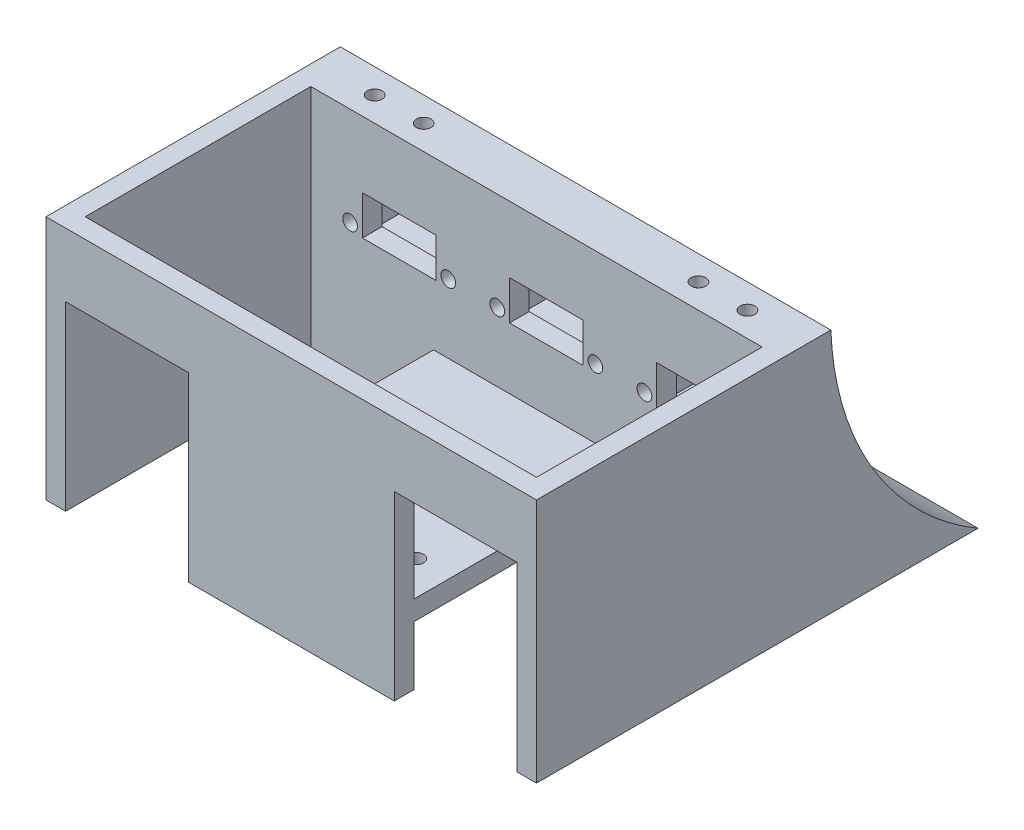
from build123d import *

# Parameters (mm, degrees)
CROQUIS1_W                          = 100
CROQUIS1_H                          = 60
SALIENTE_EXTRUIR1_DEPTH             = 50
VACIADO1_T                          = -4
SALIENTE_EXTRUIR2_REACH             = 78.811
SALIENTE_EXTRUIR2_DIRECTION_2_REACH = 78.811
CORTAR_EXTRUIR1_START               = -4
CROQUIS3_W                          = 44
CROQUIS3_H                          = 37
CORTAR_EXTRUIR1_DEPTH               = 25
CROQUIS5_W                          = 92
CROQUIS5_H                          = 46
SALIENTE_EXTRUIR3_DEPTH             = 6
CORTAR_EXTRUIR2_START               = 2
CROQUIS4_W                          = 26
CROQUIS4_H                          = 13
CORTAR_EXTRUIR2_DEPTH               = 13
CROQUIS4_3_R                        = 1.5
CROQUIS4_3_W                        = 15
CROQUIS4_3_H                        = 8
CORTAR_EXTRUIR3_DEPTH               = 6
MATRIZL2_COUNT                      = 3
MATRIZL2_PITCH                      = 30
SALIENTE_EXTRUIR4_START             = 8
SALIENTE_EXTRUIR4_DEPTH             = 4
CORTAR_EXTRUIR4_DEPTH               = 4
CROQUIS7_R                          = 1.5
CROQUIS7_W                          = 25
CROQUIS7_H                          = 6
CORTAR_EXTRUIR5_DEPTH               = 4
CORTAR_EXTRUIR6_START               = -2
CORTAR_EXTRUIR6_DEPTH               = 2
CROQUIS9_R                          = 1.5
CORTAR_EXTRUIR7_DEPTH               = 5


# Read off the part's stored shape, not the designer's step: Cortar-Extruir6
with BuildPart() as part:
    # Croquis1 → Saliente-Extruir1 (new body)
    with BuildSketch(Plane(origin=(0, 0, 0), x_dir=(1, 0, 0), z_dir=(0, 1, 0))):
        Rectangle(CROQUIS1_W, CROQUIS1_H)
    extrude(amount=SALIENTE_EXTRUIR1_DEPTH)

    # Vaciado1
    vaciado1_openings = [part.faces().sort_by_distance(p)[0] for p in [
        (0, 50, 0),
    ]]
    offset(amount=VACIADO1_T, openings=vaciado1_openings, kind=Kind.INTERSECTION)

    # Saliente-Extruir2: up to this face of the body (flat: up to its plane)
    saliente_extruir2_end = Plane(part.part.faces().sort_by_distance((50, 25, 0))[0])
    # Croquis2 → Saliente-Extruir2 (add, up to the picked face)
    with BuildSketch(Plane(origin=(0, 0, 0), x_dir=(0, 0, -1), z_dir=(1, 0, 0)), mode=Mode.PRIVATE) as saliente_extruir2_sk1:
        with BuildLine():
            Line((30, 50), (30, 0))
            Line((30, 0), (60, 0))
            ThreePointArc((60, 0), (38.605216469, 21.163129881), (30, 50))
        make_face()
    saliente_extruir2_tool1 = split(extrude(saliente_extruir2_sk1.sketch, amount=SALIENTE_EXTRUIR2_REACH, mode=Mode.PRIVATE), bisect_by=saliente_extruir2_end, keep=Keep.BOTH, mode=Mode.PRIVATE)
    add(saliente_extruir2_tool1.solids().sort_by(Axis((0, 12.297195, -38.437511), (1, 0, 0)))[0])

    # Saliente-Extruir2 direction 2: up to this face of the body (flat: up to its plane)
    saliente_extruir2_direction_2_end = Plane(part.part.faces().sort_by_distance((-50, 25, 0))[0])
    # Croquis2 → Saliente-Extruir2 direction 2 (add, up to the picked face)
    with BuildSketch(Plane(origin=(0, 0, 0), x_dir=(0, 0, -1), z_dir=(1, 0, 0)), mode=Mode.PRIVATE) as saliente_extruir2_direction_2_sk1:
        with BuildLine():
            Line((30, 50), (30, 0))
            Line((30, 0), (60, 0))
            ThreePointArc((60, 0), (38.605216469, 21.163129881), (30, 50))
        make_face()
    saliente_extruir2_direction_2_tool1 = split(extrude(saliente_extruir2_direction_2_sk1.sketch, amount=-SALIENTE_EXTRUIR2_DIRECTION_2_REACH, mode=Mode.PRIVATE), bisect_by=saliente_extruir2_direction_2_end, keep=Keep.BOTH, mode=Mode.PRIVATE)
    add(saliente_extruir2_direction_2_tool1.solids().sort_by(Axis((0, 12.297195, -38.437511), (-1, 0, 0)))[0])

    # Croquis3 → Cortar-Extruir1 (cut)
    with BuildSketch(Plane.ZY.offset(50).offset(CORTAR_EXTRUIR1_START)):
        with Locations((8, 18.5)):
            Rectangle(CROQUIS3_W, CROQUIS3_H)
    cortar_extruir1 = extrude(amount=-CORTAR_EXTRUIR1_DEPTH, mode=Mode.SUBTRACT)

    # Croquis5 → Saliente-Extruir3 (add)
    with BuildSketch(Plane.XY.offset(-26)):
        with Locations((0, 27)):
            Rectangle(CROQUIS5_W, CROQUIS5_H)
    extrude(amount=SALIENTE_EXTRUIR3_DEPTH)

    # Croquis4 → Cortar-Extruir2 (cut)
    with BuildSketch(Plane.XY.offset(-26).offset(CORTAR_EXTRUIR2_START)):
        with Locations((-28, 30)):
            Rectangle(CROQUIS4_W, CROQUIS4_H)
    cortar_extruir2 = extrude(amount=-CORTAR_EXTRUIR2_DEPTH, mode=Mode.SUBTRACT)

    # Croquis4<3> → Cortar-Extruir3 (cut)
    with BuildSketch(Plane.XY.offset(-26)):
        with Locations((-18, 30)):
            Circle(CROQUIS4_3_R)
        with Locations((-38, 30)):
            Circle(CROQUIS4_3_R)
        with Locations((-28, 32.5)):
            Rectangle(CROQUIS4_3_W, CROQUIS4_3_H)
    cortar_extruir3 = extrude(amount=CORTAR_EXTRUIR3_DEPTH, mode=Mode.SUBTRACT)

    # MatrizL2: Cortar-Extruir2, Cortar-Extruir3 ×3
    with Locations(*[(i * MATRIZL2_PITCH, 0, 0) for i in range(1, MATRIZL2_COUNT)]):
        add(cortar_extruir2, mode=Mode.SUBTRACT)
        add(cortar_extruir3, mode=Mode.SUBTRACT)

    # Croquis6 → Saliente-Extruir4 (add)
    with BuildSketch(Plane(origin=(0, 4, 0), x_dir=(1, 0, 0), z_dir=(0, 1, 0)).offset(SALIENTE_EXTRUIR4_START)):
        Polygon((46, 20), (-46, 20), (-46, 14), (-21, 14), (-21, -26), (46, -26), align=None)
    extrude(amount=SALIENTE_EXTRUIR4_DEPTH)

    # Croquis6<2> → Cortar-Extruir4 (cut)
    with BuildSketch(Plane(origin=(0, 4, 0), x_dir=(1, 0, 0), z_dir=(0, 1, 0))):
        Polygon((46, 20), (-46, 20), (-46, 14), (-21, 14), (-21, -26), (46, -26), align=None)
    extrude(amount=-CORTAR_EXTRUIR4_DEPTH, mode=Mode.SUBTRACT)

    # Croquis7 → Cortar-Extruir5 (cut)
    with BuildSketch(Plane(origin=(0, 16, 0), x_dir=(1, 0, 0), z_dir=(0, 1, 0))):
        with Locations(Location((-14.1, -18.6, 0), (0, 0, 270))):
            Circle(CROQUIS7_R)
        with Locations(Location((-14.1, 4.4, 0), (0, 0, 270))):
            Circle(CROQUIS7_R)
        with Locations((-33.5, 17)):
            Rectangle(CROQUIS7_W, CROQUIS7_H)
    cortar_extruir5 = extrude(amount=-CORTAR_EXTRUIR5_DEPTH, mode=Mode.SUBTRACT)

    # Cortar-Extruir6 outline → Cortar-Extruir6 (cut)
    # profile 1 of 7: a face of its own
    with BuildSketch(Plane.XZ.offset(CORTAR_EXTRUIR6_START)):
        with BuildLine():
            add(Edge.make_bspline(
                [(18.888271585, -42.352393977), (18.884484386, -42.423868512), (18.876982857, -42.565442321), (18.813577354, -42.76853097), (18.712467671, -42.954955074), (18.571846334, -43.120483121), (18.394972631, -43.265694686), (18.179407906, -43.375225333), (17.935081569, -43.448844865), (17.76258819, -43.457813268), (17.674797559, -43.462377743)],
                knots=[0, 0, 0, 0, 0.116932385, 0.231614839, 0.34522054, 0.462467825, 0.585400328, 0.717791731, 0.856369898, 1, 1, 1, 1], degree=3))
            add(Edge.make_bspline(
                [(17.674797559, -41.254585535), (17.763389132, -41.258694265), (17.935697765, -41.266685653), (18.177177697, -41.34503228), (18.392463639, -41.452351176), (18.571177721, -41.596634907), (18.717121011, -41.760131049), (18.814170619, -41.947213877), (18.876740836, -42.145501203), (18.884400246, -42.282931699), (18.888271585, -42.352393977)],
                knots=[0, 0, 0, 0, 0.145662332, 0.283309988, 0.415047197, 0.54050675, 0.659953064, 0.773758148, 0.885649294, 1, 1, 1, 1], degree=3))
            add(Edge.make_bspline(
                [(16.58307678, -42.364569301), (16.58652142, -42.28696319), (16.593261486, -42.135112676), (16.659638507, -41.918883094), (16.759439169, -41.72601533), (16.895115639, -41.562632424), (17.056479671, -41.427973634), (17.246142952, -41.331900385), (17.45395748, -41.26494248), (17.600539476, -41.258068086), (17.674797559, -41.254585535)],
                knots=[0, 0, 0, 0, 0.133733755, 0.26167449, 0.387130703, 0.506684142, 0.62623758, 0.747503629, 0.872085953, 1, 1, 1, 1], degree=3))
            add(Edge.make_bspline(
                [(17.674797559, -43.462377743), (17.599321746, -43.458606869), (17.451193809, -43.451206198), (17.239787685, -43.389378358), (17.054227298, -43.287246715), (16.890184198, -43.159675217), (16.758807001, -42.997357071), (16.658466944, -42.808565511), (16.593408285, -42.593932994), (16.58657107, -42.442143981), (16.58307678, -42.364569301)],
                knots=[0, 0, 0, 0, 0.130782073, 0.256671348, 0.377953313, 0.496525494, 0.614923347, 0.737239779, 0.865711362, 1, 1, 1, 1], degree=3))
        make_face()
    # profile 2 of 7: a face of its own
    with BuildSketch(Plane.XZ.offset(CORTAR_EXTRUIR6_START)):
        with BuildLine():
            add(Edge.make_bspline(
                [(9.961729377, -33.202637483), (10.078086415, -33.20396258), (10.306179155, -33.206560146), (10.641305435, -33.222314884), (10.962051584, -33.251193631), (11.269559714, -33.289071545), (11.563563058, -33.33939217), (11.843716201, -33.402618139), (12.109982733, -33.475309646), (12.36257057, -33.558790311), (12.602442614, -33.652057186), (12.830212297, -33.755455269), (13.045308722, -33.869305582), (13.248379923, -33.991384069), (13.440925399, -34.120089244), (13.616724077, -34.264275749), (13.783741804, -34.412883651), (13.986441364, -34.625165883), (14.214017896, -34.910386783), (14.44526318, -35.283963823), (14.630151513, -35.689662854), (14.772665977, -36.123167), (14.879795025, -36.58187545), (14.952457445, -37.063099713), (15.001942006, -37.566460721), (15.006217323, -37.909628466), (15.008401455, -38.084942678)],
                knots=[0, 0, 0, 0, 0.043180069, 0.084645162, 0.124459927, 0.162661114, 0.199594386, 0.235096819, 0.269197997, 0.301980353, 0.333770389, 0.364660784, 0.394752534, 0.424024931, 0.452569381, 0.48059819, 0.508323011, 0.535484198, 0.589424801, 0.643410939, 0.698108386, 0.754465297, 0.812487963, 0.872697628, 0.934964998, 1, 1, 1, 1], degree=3))
            Line((9.961729377, -33.202637483), (5.771388468, -33.202637483))
            Line((5.771388468, -33.202637483), (5.771388468, -33.981858262))
            Line((5.771388468, -33.981858262), (7.116761845, -33.981858262))
            Line((7.116761845, -33.981858262), (7.116761845, -42.423416704))
            Line((7.116761845, -42.423416704), (5.771388468, -42.423416704))
            Line((5.771388468, -42.423416704), (5.771388468, -43.202637483))
            Line((5.771388468, -43.202637483), (9.860268339, -43.202637483))
            add(Edge.make_bspline(
                [(15.008401455, -38.084942678), (15.004738902, -38.291405953), (14.997407606, -38.704681395), (14.941688972, -39.218452009), (14.875402695, -39.625366999), (14.808741523, -39.92495049), (14.724708647, -40.218768001), (14.626169232, -40.505712764), (14.51053056, -40.785736663), (14.374241877, -41.055312379), (14.219607314, -41.315622483), (14.047019061, -41.566374551), (13.852501182, -41.806201693), (13.62690437, -42.0271023), (13.376968106, -42.234899034), (13.098980862, -42.425828897), (12.794904929, -42.601762358), (12.459414016, -42.751394481), (12.099579316, -42.889914253), (11.70885419, -43.001415556), (11.289882939, -43.094852833), (10.839633371, -43.153985425), (10.360310068, -43.197604147), (10.030157565, -43.200927406), (9.860268339, -43.202637483)],
                knots=[0, 0, 0, 0, 0.074322882, 0.148771358, 0.185807886, 0.222738558, 0.25920372, 0.295789058, 0.331928241, 0.368198494, 0.404454025, 0.440867911, 0.477727844, 0.515443619, 0.554360706, 0.594625465, 0.636736502, 0.680657414, 0.726750954, 0.775461095, 0.826815655, 0.881167312, 0.938851309, 1, 1, 1, 1], degree=3))
        make_face()
        with BuildLine():
            add(Edge.make_bspline(
                [(13.159781326, -38.099147223), (13.158632612, -37.983481359), (13.156381956, -37.756859088), (13.149635749, -37.424590376), (13.13240756, -37.10666968), (13.111310337, -36.803388039), (13.080698489, -36.515776375), (13.043579106, -36.244514677), (12.992432815, -35.990643527), (12.931685925, -35.752860866), (12.862116119, -35.531008526), (12.777204563, -35.327104304), (12.68554965, -35.136670312), (12.576272511, -34.963955156), (12.457389878, -34.803322315), (12.318766809, -34.660812858), (12.167259448, -34.529720799), (11.996238881, -34.416626125), (11.810081477, -34.312825201), (11.601716837, -34.227092534), (11.373790391, -34.152133468), (11.125100472, -34.08902294), (10.854490136, -34.04079603), (10.561657054, -34.00775423), (10.246213269, -33.983813067), (10.028067166, -33.982525357), (9.9150573, -33.981858262)],
                knots=[0, 0, 0, 0, 0.056108201, 0.109931898, 0.161182084, 0.210528593, 0.257377396, 0.301457147, 0.343281306, 0.382910323, 0.42047119, 0.455931338, 0.489972749, 0.522838048, 0.554926075, 0.586717515, 0.619066154, 0.65191671, 0.685983409, 0.722301395, 0.761001391, 0.802301068, 0.846642567, 0.894216443, 0.945199179, 1, 1, 1, 1], degree=3))
            add(Edge.make_bspline(
                [(9.773011845, -42.423416704), (9.934758077, -42.421383786), (10.243819718, -42.417499326), (10.684926964, -42.380177837), (11.081683396, -42.324191183), (11.435541481, -42.240266101), (11.749786376, -42.123775868), (12.02857349, -41.974698801), (12.269879393, -41.785964231), (12.479838904, -41.562716937), (12.655318795, -41.295723843), (12.800559432, -40.985532476), (12.919944821, -40.632283672), (12.992811461, -40.307447484), (13.039660285, -40.024661374), (13.071938869, -39.793228818), (13.1008174, -39.547056154), (13.122770551, -39.285814874), (13.138407109, -39.009702532), (13.150412184, -38.719490026), (13.159259354, -38.414406806), (13.159604367, -38.206026271), (13.159781326, -38.099147223)],
                knots=[0, 0, 0, 0, 0.074436008, 0.142230916, 0.203611821, 0.258737414, 0.30928069, 0.357486624, 0.40363574, 0.449674445, 0.497945689, 0.550030491, 0.60694023, 0.669249064, 0.703031575, 0.738873314, 0.776797949, 0.817107808, 0.859524554, 0.904086725, 0.950805773, 1, 1, 1, 1], degree=3))
            Line((9.773011845, -42.423416704), (8.817248858, -42.423416704))
            Line((8.817248858, -42.423416704), (8.817248858, -33.981858262))
            Line((8.817248858, -33.981858262), (9.9150573, -33.981858262))
        make_face(mode=Mode.SUBTRACT)
    # profile 3 of 7: a face of its own
    with BuildSketch(Plane.XZ.offset(CORTAR_EXTRUIR6_START)):
        with BuildLine():
            add(Edge.make_bspline(
                [(4.6025573, -42.352393977), (4.5987701, -42.423868512), (4.591268571, -42.565442321), (4.527863068, -42.76853097), (4.426753385, -42.954955074), (4.286132049, -43.120483121), (4.109258346, -43.265694686), (3.89369362, -43.375225333), (3.649367283, -43.448844865), (3.476873904, -43.457813268), (3.389083274, -43.462377743)],
                knots=[0, 0, 0, 0, 0.116932385, 0.231614839, 0.34522054, 0.462467825, 0.585400328, 0.717791731, 0.856369898, 1, 1, 1, 1], degree=3))
            add(Edge.make_bspline(
                [(3.389083274, -41.254585535), (3.477674846, -41.258694265), (3.64998348, -41.266685653), (3.891463411, -41.34503228), (4.106749353, -41.452351176), (4.285463436, -41.596634907), (4.431406726, -41.760131049), (4.528456334, -41.947213877), (4.591026551, -42.145501203), (4.59868596, -42.282931699), (4.6025573, -42.352393977)],
                knots=[0, 0, 0, 0, 0.145662332, 0.283309988, 0.415047197, 0.54050675, 0.659953064, 0.773758148, 0.885649294, 1, 1, 1, 1], degree=3))
            add(Edge.make_bspline(
                [(2.297362494, -42.364569301), (2.300807134, -42.28696319), (2.3075472, -42.135112676), (2.373924222, -41.918883094), (2.473724883, -41.72601533), (2.609401354, -41.562632424), (2.770765386, -41.427973634), (2.960428666, -41.331900385), (3.168243194, -41.26494248), (3.314825191, -41.258068086), (3.389083274, -41.254585535)],
                knots=[0, 0, 0, 0, 0.133733755, 0.26167449, 0.387130703, 0.506684142, 0.62623758, 0.747503629, 0.872085953, 1, 1, 1, 1], degree=3))
            add(Edge.make_bspline(
                [(3.389083274, -43.462377743), (3.31360746, -43.458606869), (3.165479523, -43.451206198), (2.954073399, -43.389378358), (2.768513012, -43.287246715), (2.604469912, -43.159675217), (2.473092715, -42.997357071), (2.372752659, -42.808565511), (2.307693999, -42.593932994), (2.300856784, -42.442143981), (2.297362494, -42.364569301)],
                knots=[0, 0, 0, 0, 0.130782073, 0.256671348, 0.377953313, 0.496525494, 0.614923347, 0.737239779, 0.865711362, 1, 1, 1, 1], degree=3))
        make_face()
    # profile 4 of 7: a face of its own
    with BuildSketch(Plane.XZ.offset(CORTAR_EXTRUIR6_START)):
        with BuildLine():
            add(Edge.make_bspline(
                [(-3.93843296, -37.618221899), (-3.866724146, -37.617956306), (-3.730718823, -37.617452575), (-3.538649118, -37.610474934), (-3.368606751, -37.603920455), (-3.219564747, -37.58973592), (-3.087319514, -37.569939739), (-2.972740665, -37.531903837), (-2.870914516, -37.48616399), (-2.782415559, -37.423675609), (-2.707169746, -37.339970181), (-2.640560877, -37.236934022), (-2.586763342, -37.109184649), (-2.536583513, -36.956836816), (-2.494399188, -36.767296058), (-2.45907824, -36.532699185), (-2.429754946, -36.248203247), (-2.414574041, -36.041564366), (-2.406371272, -35.92991021)],
                knots=[0, 0, 0, 0, 0.077918038, 0.147781943, 0.208861328, 0.262765604, 0.310498151, 0.353734685, 0.393522182, 0.431460662, 0.470473383, 0.515123849, 0.564157341, 0.620640993, 0.689287881, 0.774847026, 0.878342037, 1, 1, 1, 1], degree=3))
            Line((-3.93843296, -37.618221899), (-4.559374519, -37.618221899))
            Line((-4.559374519, -37.618221899), (-4.559374519, -33.981858262))
            Line((-4.559374519, -33.981858262), (-2.68843296, -33.981858262))
            add(Edge.make_bspline(
                [(-0.36903361, -36.18965047), (-0.387720016, -36.066387923), (-0.422831537, -35.834779149), (-0.485798383, -35.512698009), (-0.549465718, -35.237328029), (-0.618077827, -35.004681033), (-0.69735547, -34.807676051), (-0.782525138, -34.634170654), (-0.887279014, -34.488204407), (-1.002541053, -34.362293406), (-1.136080659, -34.259130945), (-1.288023053, -34.172833804), (-1.461971895, -34.106401825), (-1.658008907, -34.059212051), (-1.877035529, -34.022353755), (-2.1226234, -34.000483018), (-2.395964112, -33.982543953), (-2.58761115, -33.982094638), (-2.68843296, -33.981858262)],
                knots=[0, 0, 0, 0, 0.100276022, 0.188417382, 0.263906678, 0.327592325, 0.383263949, 0.434608959, 0.482616625, 0.527272883, 0.57146264, 0.617759396, 0.667371346, 0.720685132, 0.77972221, 0.84588167, 0.918921319, 1, 1, 1, 1], degree=3))
            Line((-0.36903361, -36.18965047), (0.475122235, -36.18965047))
            Line((0.475122235, -36.18965047), (0.331047559, -33.202637483))
            Line((0.331047559, -33.202637483), (-7.605234908, -33.202637483))
            Line((-7.605234908, -33.202637483), (-7.605234908, -33.981858262))
            Line((-7.605234908, -33.981858262), (-6.259861532, -33.981858262))
            Line((-6.259861532, -33.981858262), (-6.259861532, -42.423416704))
            Line((-6.259861532, -42.423416704), (-7.605234908, -42.423416704))
            Line((-7.605234908, -42.423416704), (-7.605234908, -43.202637483))
            Line((-7.605234908, -43.202637483), (0.499472884, -43.202637483))
            Line((0.499472884, -43.202637483), (0.643547559, -39.566273847))
            Line((0.643547559, -39.566273847), (-0.200608285, -39.566273847))
            add(Edge.make_bspline(
                [(-3.037458934, -42.423416704), (-2.95222315, -42.423254394), (-2.788472159, -42.422942572), (-2.553037934, -42.414305081), (-2.337211579, -42.402219708), (-2.081856363, -42.382501774), (-1.794688199, -42.339357379), (-1.485289246, -42.254108032), (-1.220491867, -42.130934321), (-1.034926991, -41.992295598), (-0.909010628, -41.860943165), (-0.822336186, -41.746617676), (-0.741094244, -41.618226653), (-0.665393011, -41.474258435), (-0.595410692, -41.313843199), (-0.527531275, -41.137768625), (-0.469924642, -40.943172154), (-0.414281031, -40.729335796), (-0.361595237, -40.487420782), (-0.307025844, -40.212838439), (-0.252271604, -39.901609544), (-0.218438939, -39.682008859), (-0.200608285, -39.566273847)],
                knots=[0, 0, 0, 0, 0.05445262, 0.104611819, 0.150493048, 0.192553926, 0.268220917, 0.335654327, 0.396929789, 0.45371437, 0.482445036, 0.512956787, 0.545206301, 0.579422652, 0.616763016, 0.656973875, 0.699898362, 0.746331873, 0.798126817, 0.858046255, 0.925186852, 1, 1, 1, 1], degree=3))
            Line((-3.037458934, -42.423416704), (-4.559374519, -42.423416704))
            Line((-4.559374519, -42.423416704), (-4.559374519, -38.397442678))
            Line((-4.559374519, -38.397442678), (-3.93843296, -38.397442678))
            add(Edge.make_bspline(
                [(-2.408400493, -40.215624496), (-2.415235091, -40.101943361), (-2.427939171, -39.890634033), (-2.454259566, -39.59831022), (-2.482784406, -39.354223102), (-2.519522466, -39.154213795), (-2.562462387, -38.989898952), (-2.611932202, -38.851058474), (-2.674743506, -38.736996361), (-2.747550901, -38.642848259), (-2.83611049, -38.569976161), (-2.940298527, -38.512974523), (-3.060297395, -38.467708989), (-3.199064233, -38.441944569), (-3.354901007, -38.421474011), (-3.531097717, -38.408764798), (-3.727922551, -38.397215006), (-3.866035541, -38.397364378), (-3.93843296, -38.397442678)],
                knots=[0, 0, 0, 0, 0.118856032, 0.220928374, 0.306303417, 0.375257054, 0.432965082, 0.483450198, 0.528637455, 0.568328747, 0.606925072, 0.647381224, 0.691834584, 0.740155793, 0.794271569, 0.855888985, 0.924458477, 1, 1, 1, 1], degree=3))
            Line((-2.408400493, -40.215624496), (-1.548010882, -40.215624496))
            Line((-1.548010882, -40.215624496), (-1.548010882, -35.92991021))
            Line((-1.548010882, -35.92991021), (-2.406371272, -35.92991021))
        make_face()
    # profile 5 of 7: a face of its own
    with BuildSketch(Plane.XZ.offset(CORTAR_EXTRUIR6_START)):
        with BuildLine():
            add(Edge.make_bspline(
                [(-8.774066077, -42.352393977), (-8.777853277, -42.423868512), (-8.785354806, -42.565442321), (-8.848760308, -42.76853097), (-8.949869992, -42.954955074), (-9.090491328, -43.120483121), (-9.267365031, -43.265694686), (-9.482929757, -43.375225333), (-9.727256093, -43.448844865), (-9.899749473, -43.457813268), (-9.987540103, -43.462377743)],
                knots=[0, 0, 0, 0, 0.116932385, 0.231614839, 0.34522054, 0.462467825, 0.585400328, 0.717791731, 0.856369898, 1, 1, 1, 1], degree=3))
            add(Edge.make_bspline(
                [(-9.987540103, -41.254585535), (-9.898948531, -41.258694265), (-9.726639897, -41.266685653), (-9.485159966, -41.34503228), (-9.269874023, -41.452351176), (-9.091159941, -41.596634907), (-8.945216651, -41.760131049), (-8.848167043, -41.947213877), (-8.785596826, -42.145501203), (-8.777937416, -42.282931699), (-8.774066077, -42.352393977)],
                knots=[0, 0, 0, 0, 0.145662332, 0.283309988, 0.415047197, 0.54050675, 0.659953064, 0.773758148, 0.885649294, 1, 1, 1, 1], degree=3))
            add(Edge.make_bspline(
                [(-11.079260882, -42.364569301), (-11.075816243, -42.28696319), (-11.069076177, -42.135112676), (-11.002699155, -41.918883094), (-10.902898494, -41.72601533), (-10.767222023, -41.562632424), (-10.605857991, -41.427973634), (-10.41619471, -41.331900385), (-10.208380183, -41.26494248), (-10.061798186, -41.258068086), (-9.987540103, -41.254585535)],
                knots=[0, 0, 0, 0, 0.133733755, 0.26167449, 0.387130703, 0.506684142, 0.62623758, 0.747503629, 0.872085953, 1, 1, 1, 1], degree=3))
            add(Edge.make_bspline(
                [(-9.987540103, -43.462377743), (-10.063015916, -43.458606869), (-10.211143854, -43.451206198), (-10.422549978, -43.389378358), (-10.608110365, -43.287246715), (-10.772153464, -43.159675217), (-10.903530662, -42.997357071), (-11.003870718, -42.808565511), (-11.068929378, -42.593932994), (-11.075766593, -42.442143981), (-11.079260882, -42.364569301)],
                knots=[0, 0, 0, 0, 0.130782073, 0.256671348, 0.377953313, 0.496525494, 0.614923347, 0.737239779, 0.865711362, 1, 1, 1, 1], degree=3))
        make_face()
    # profile 6 of 7: a face of its own
    with BuildSketch(Plane.XZ.offset(CORTAR_EXTRUIR6_START)):
        with BuildLine():
            add(Edge.make_bspline(
                [(-16.531777116, -33.202637483), (-16.34569351, -33.205365552), (-15.987260158, -33.210620346), (-15.471365662, -33.250421692), (-14.998094614, -33.318870039), (-14.566614196, -33.413558413), (-14.174825373, -33.53277325), (-13.82223328, -33.675607647), (-13.504585334, -33.835303061), (-13.230031793, -34.024503929), (-12.990107746, -34.22747878), (-12.787035807, -34.447447571), (-12.622513517, -34.684321714), (-12.499173595, -34.937494378), (-12.404725467, -35.201056145), (-12.341953376, -35.475810305), (-12.298171524, -35.760085079), (-12.294566859, -35.953411669), (-12.292734908, -36.051663457)],
                knots=[0, 0, 0, 0, 0.096635634, 0.186139095, 0.268508575, 0.344789968, 0.415350008, 0.48090933, 0.542183756, 0.599572947, 0.653640576, 0.70510764, 0.754608169, 0.802838432, 0.850949572, 0.89968761, 0.949019575, 1, 1, 1, 1], degree=3))
            Line((-16.531777116, -33.202637483), (-20.332507635, -33.202637483))
            Line((-20.332507635, -33.202637483), (-20.332507635, -33.981858262))
            Line((-20.332507635, -33.981858262), (-18.987134259, -33.981858262))
            Line((-18.987134259, -33.981858262), (-18.987134259, -42.423416704))
            Line((-18.987134259, -42.423416704), (-20.332507635, -42.423416704))
            Line((-20.332507635, -42.423416704), (-20.332507635, -43.202637483))
            Line((-20.332507635, -43.202637483), (-15.876338804, -43.202637483))
            Line((-15.876338804, -43.202637483), (-15.876338804, -42.423416704))
            Line((-15.876338804, -42.423416704), (-17.286647246, -42.423416704))
            Line((-17.286647246, -42.423416704), (-17.286647246, -39.176663457))
            Line((-17.286647246, -39.176663457), (-16.61903361, -39.176663457))
            add(Edge.make_bspline(
                [(-12.292734908, -36.051663457), (-12.295046803, -36.145134547), (-12.299687975, -36.332779526), (-12.338453145, -36.612875221), (-12.396226007, -36.892360545), (-12.481649658, -37.168731471), (-12.595153691, -37.440493644), (-12.75354923, -37.699329697), (-12.948630913, -37.946293807), (-13.182110837, -38.181131338), (-13.454840445, -38.400645118), (-13.775152683, -38.590949704), (-14.133977323, -38.765468081), (-14.464249797, -38.884405226), (-14.748334716, -38.970866485), (-14.979004032, -39.024947215), (-15.221435872, -39.071147742), (-15.476601519, -39.109964671), (-15.744010187, -39.139842649), (-16.024803409, -39.162710171), (-16.317932618, -39.174246293), (-16.517564246, -39.175848886), (-16.61903361, -39.176663457)],
                knots=[0, 0, 0, 0, 0.046474032, 0.093297498, 0.140412582, 0.188302147, 0.236986429, 0.286493836, 0.338724998, 0.393206089, 0.450900237, 0.512352899, 0.578112404, 0.649113025, 0.686688686, 0.725777805, 0.766886769, 0.809426141, 0.854123434, 0.90070087, 0.94952794, 1, 1, 1, 1], degree=3))
        make_face()
        with BuildLine():
            add(Edge.make_bspline(
                [(-14.114975168, -36.078043327), (-14.116028961, -35.988046745), (-14.118051772, -35.815293631), (-14.136573057, -35.565977116), (-14.166197023, -35.33747968), (-14.208007628, -35.127941067), (-14.266007704, -34.937151691), (-14.345203437, -34.764174417), (-14.447931347, -34.61070104), (-14.571827358, -34.473973496), (-14.720760592, -34.35439945), (-14.897727367, -34.253178617), (-15.10300464, -34.167889294), (-15.338796014, -34.100146642), (-15.606018778, -34.04543641), (-15.909241452, -34.007819081), (-16.248730433, -33.986586436), (-16.487779093, -33.983483154), (-16.612945947, -33.981858262)],
                knots=[0, 0, 0, 0, 0.070034476, 0.134434815, 0.194444482, 0.249267706, 0.300551824, 0.349306637, 0.396759397, 0.443716055, 0.492388375, 0.54475802, 0.601856862, 0.664988103, 0.735401446, 0.81395415, 0.902585634, 1, 1, 1, 1], degree=3))
            add(Edge.make_bspline(
                [(-16.720494648, -38.397442678), (-16.59872648, -38.395601591), (-16.366510419, -38.392090574), (-16.033694493, -38.373526799), (-15.733901788, -38.335992082), (-15.463504803, -38.290462777), (-15.22368713, -38.221597378), (-15.008899203, -38.141862447), (-14.824195156, -38.035535708), (-14.661689895, -37.915109729), (-14.523955798, -37.770942681), (-14.409983726, -37.603347303), (-14.313408102, -37.414905424), (-14.239031326, -37.20093052), (-14.182789403, -36.960754018), (-14.143427585, -36.692627203), (-14.11903092, -36.395052948), (-14.116369084, -36.186995962), (-14.114975168, -36.078043327)],
                knots=[0, 0, 0, 0, 0.088580303, 0.168925666, 0.242276937, 0.308284501, 0.368093327, 0.42355103, 0.474445387, 0.522562541, 0.570234953, 0.618682986, 0.669510715, 0.723819516, 0.783007934, 0.848692001, 0.920764953, 1, 1, 1, 1], degree=3))
            Line((-16.720494648, -38.397442678), (-17.286647246, -38.397442678))
            Line((-17.286647246, -38.397442678), (-17.286647246, -33.981858262))
            Line((-17.286647246, -33.981858262), (-16.612945947, -33.981858262))
        make_face(mode=Mode.SUBTRACT)
    # profile 7 of 7: a face of its own
    with BuildSketch(Plane.XZ.offset(CORTAR_EXTRUIR6_START)):
        Polygon((23.01570665, -42.423416704), (21.670333274, -42.423416704), (22.689002105, -39.826014106), (25.558320287, -39.826014106), (26.53031704, -42.423416704), (25.132183923, -42.423416704), (25.132183923, -43.202637483), (29.65531704, -43.202637483), (29.65531704, -42.423416704), (28.279505352, -42.423416704), (24.998255352, -33.202637483), (24.164245611, -33.202637483), (20.669927429, -42.423416704), (19.352963144, -42.423416704), (19.352963144, -43.202637483), (23.01570665, -43.202637483), align=None)
        Polygon((24.196064566, -35.861865271), (25.335106001, -39.046793327), (22.948742365, -39.046793327), align=None, mode=Mode.SUBTRACT)
    extrude(amount=CORTAR_EXTRUIR6_DEPTH, mode=Mode.SUBTRACT)

    # Croquis9 → Cortar-Extruir7 (cut)
    with BuildSketch(Plane(origin=(0, 50, 0), x_dir=(1, 0, 0), z_dir=(0, 1, 0))):
        with Locations(Location((-38, 25, 0), (0, 0, 270))):
            Circle(CROQUIS9_R)
        with Locations(Location((-28, 25, 0), (0, 0, 270))):
            Circle(CROQUIS9_R)
    cortar_extruir7 = extrude(amount=-CORTAR_EXTRUIR7_DEPTH, mode=Mode.SUBTRACT)

    # Simetría1: Cortar-Extruir5, Cortar-Extruir7 across plane
    add(cortar_extruir5.mirror(Plane(origin=(0, 0, 0), x_dir=(0, 0, 1), z_dir=(1, 0, 0))), mode=Mode.SUBTRACT)
    add(cortar_extruir7.mirror(Plane(origin=(0, 0, 0), x_dir=(0, 0, 1), z_dir=(1, 0, 0))), mode=Mode.SUBTRACT)

    # Simetría2: Cortar-Extruir1 across plane
    add(cortar_extruir1.mirror(Plane(origin=(0, 0, 0), x_dir=(0, 0, 1), z_dir=(1, 0, 0))), mode=Mode.SUBTRACT)


solid = part.part
